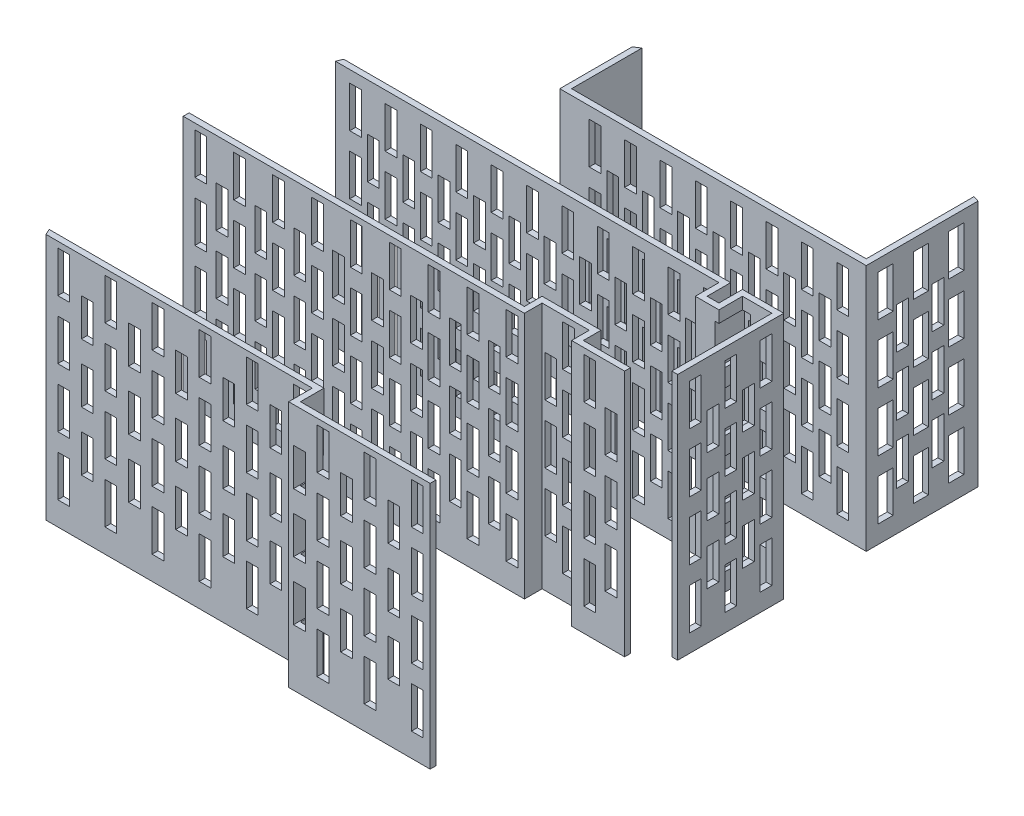
from build123d import *

# Parameters (mm, degrees)
EXTRUDE_1_DEPTH     = 21
EXTRUDE_1_2_DEPTH   = 21
EXTRUDE_1_3_DEPTH   = 21
EXTRUDE_1_4_DEPTH   = 21
SKETCH_3_W          = 1
SKETCH_3_H          = 3.5
SKETCH_3_H_2        = 3.183776242
CUT_EXTRUDE_1_DEPTH = 5
SKETCH_4_W          = 1
SKETCH_4_H          = 3.5
CUT_EXTRUDE_2_DEPTH = 5
SKETCH_5_W          = 1
SKETCH_5_H          = 3.5
CUT_EXTRUDE_3_DEPTH = 3
SKETCH_6_W          = 1
SKETCH_6_H          = 3.5
CUT_EXTRUDE_4_DEPTH = 3
SKETCH_7_W          = 1
SKETCH_7_H          = 3.5
SKETCH_7_H_2        = 3.104321798
CUT_EXTRUDE_5_DEPTH = 2
SKETCH_8_W          = 1.279920776
SKETCH_8_H          = 3.5
SKETCH_8_W_2        = 1
CUT_EXTRUDE_6_DEPTH = 2


with BuildPart() as part:
    # 草图1 → 凸台-拉伸1 (new body)
    with BuildSketch(Plane(origin=(0, 0, 0), x_dir=(1, 0, 0), z_dir=(0, 1, 0))):
        with BuildLine():
            Line((-16, 25.966324345), (-16, 20))
            Line((-16, 20), (9, 20))
            Line((9, 20), (9, 29.141894242))
            Line((9, 29.141894242), (9.5, 28.982753492))
            Line((9.5, 28.982753492), (9.5, 19.5))
            Line((9.5, 19.5), (-16.5, 19.5))
            Line((-16.5, 19.5), (-16.5, 25.651510677))
            ThreePointArc((-16.5, 25.651510677), (-16.250762349, 25.810128304), (-16, 25.966324345))
        make_face()
    extrude(amount=EXTRUDE_1_DEPTH)

    # 草图5 → 切除-拉伸3 (cut)
    with BuildSketch(Plane(origin=(0, 0, -20), x_dir=(-1, 0, 0), z_dir=(0, 0, -1))):
        with Locations((-7.5, 18.25)):
            Rectangle(SKETCH_5_W, SKETCH_5_H)
        with Locations((-4.5, 18.25)):
            Rectangle(SKETCH_5_W, SKETCH_5_H)
        with Locations((-1.5, 18.25)):
            Rectangle(SKETCH_5_W, SKETCH_5_H)
        with Locations((1.5, 18.25)):
            Rectangle(SKETCH_5_W, SKETCH_5_H)
        with Locations((4.5, 18.25)):
            Rectangle(SKETCH_5_W, SKETCH_5_H)
        with Locations((7.5, 18.25)):
            Rectangle(SKETCH_5_W, SKETCH_5_H)
        with Locations((10.5, 18.25)):
            Rectangle(SKETCH_5_W, SKETCH_5_H)
        with Locations((13.5, 18.25)):
            Rectangle(SKETCH_5_W, SKETCH_5_H)
        with Locations((-7.5, 13.25)):
            Rectangle(SKETCH_5_W, SKETCH_5_H)
        with Locations((-4.5, 13.25)):
            Rectangle(SKETCH_5_W, SKETCH_5_H)
        with Locations((-1.5, 13.25)):
            Rectangle(SKETCH_5_W, SKETCH_5_H)
        with Locations((1.5, 13.25)):
            Rectangle(SKETCH_5_W, SKETCH_5_H)
        with Locations((4.5, 13.25)):
            Rectangle(SKETCH_5_W, SKETCH_5_H)
        with Locations((7.5, 13.25)):
            Rectangle(SKETCH_5_W, SKETCH_5_H)
        with Locations((10.5, 13.25)):
            Rectangle(SKETCH_5_W, SKETCH_5_H)
        with Locations((13.5, 13.25)):
            Rectangle(SKETCH_5_W, SKETCH_5_H)
        with Locations((-7.5, 8.25)):
            Rectangle(SKETCH_5_W, SKETCH_5_H)
        with Locations((-4.5, 8.25)):
            Rectangle(SKETCH_5_W, SKETCH_5_H)
        with Locations((-1.5, 8.25)):
            Rectangle(SKETCH_5_W, SKETCH_5_H)
        with Locations((1.5, 8.25)):
            Rectangle(SKETCH_5_W, SKETCH_5_H)
        with Locations((4.5, 8.25)):
            Rectangle(SKETCH_5_W, SKETCH_5_H)
        with Locations((7.5, 8.25)):
            Rectangle(SKETCH_5_W, SKETCH_5_H)
        with Locations((10.5, 8.25)):
            Rectangle(SKETCH_5_W, SKETCH_5_H)
        with Locations((13.5, 8.25)):
            Rectangle(SKETCH_5_W, SKETCH_5_H)
        with Locations((-7.5, 3.25)):
            Rectangle(SKETCH_5_W, SKETCH_5_H)
        with Locations((-4.5, 3.25)):
            Rectangle(SKETCH_5_W, SKETCH_5_H)
        with Locations((-1.5, 3.25)):
            Rectangle(SKETCH_5_W, SKETCH_5_H)
        with Locations((1.5, 3.25)):
            Rectangle(SKETCH_5_W, SKETCH_5_H)
        with Locations((4.5, 3.25)):
            Rectangle(SKETCH_5_W, SKETCH_5_H)
        with Locations((7.5, 3.25)):
            Rectangle(SKETCH_5_W, SKETCH_5_H)
        with Locations((10.5, 3.25)):
            Rectangle(SKETCH_5_W, SKETCH_5_H)
        with Locations((13.5, 3.25)):
            Rectangle(SKETCH_5_W, SKETCH_5_H)
        with Locations((-3, 15.25)):
            Rectangle(SKETCH_5_W, SKETCH_5_H)
        with Locations((-6, 15.25)):
            Rectangle(SKETCH_5_W, SKETCH_5_H)
        with Locations((0, 15.25)):
            Rectangle(SKETCH_5_W, SKETCH_5_H)
        with Locations((3, 15.25)):
            Rectangle(SKETCH_5_W, SKETCH_5_H)
        with Locations((6, 15.25)):
            Rectangle(SKETCH_5_W, SKETCH_5_H)
        with Locations((9, 15.25)):
            Rectangle(SKETCH_5_W, SKETCH_5_H)
        with Locations((12, 15.25)):
            Rectangle(SKETCH_5_W, SKETCH_5_H)
        with Locations((-6, 10.25)):
            Rectangle(SKETCH_5_W, SKETCH_5_H)
        with Locations((-3, 10.25)):
            Rectangle(SKETCH_5_W, SKETCH_5_H)
        with Locations((0, 10.25)):
            Rectangle(SKETCH_5_W, SKETCH_5_H)
        with Locations((3, 10.25)):
            Rectangle(SKETCH_5_W, SKETCH_5_H)
        with Locations((6, 10.25)):
            Rectangle(SKETCH_5_W, SKETCH_5_H)
        with Locations((9, 10.25)):
            Rectangle(SKETCH_5_W, SKETCH_5_H)
        with Locations((12, 10.25)):
            Rectangle(SKETCH_5_W, SKETCH_5_H)
        with Locations((-6, 5.25)):
            Rectangle(SKETCH_5_W, SKETCH_5_H)
        with Locations((-3, 5.25)):
            Rectangle(SKETCH_5_W, SKETCH_5_H)
        with Locations((0, 5.25)):
            Rectangle(SKETCH_5_W, SKETCH_5_H)
        with Locations((3, 5.25)):
            Rectangle(SKETCH_5_W, SKETCH_5_H)
        with Locations((6, 5.25)):
            Rectangle(SKETCH_5_W, SKETCH_5_H)
        with Locations((9, 5.25)):
            Rectangle(SKETCH_5_W, SKETCH_5_H)
        with Locations((12, 5.25)):
            Rectangle(SKETCH_5_W, SKETCH_5_H)
    extrude(amount=-CUT_EXTRUDE_3_DEPTH, mode=Mode.SUBTRACT)

    # 草图8 → 切除-拉伸6 (cut)
    with BuildSketch(Plane(origin=(9.5, 0, 0), x_dir=(0, 0, -1), z_dir=(1, 0, 0))):
        with Locations((21.139960388, 18.261135418)):
            Rectangle(SKETCH_8_W, SKETCH_8_H)
        with Locations((24.139960388, 18.261135418)):
            Rectangle(SKETCH_8_W, SKETCH_8_H)
        with Locations((27.139960388, 18.261135418)):
            Rectangle(SKETCH_8_W, SKETCH_8_H)
        with Locations((21.139960388, 13.261135418)):
            Rectangle(SKETCH_8_W, SKETCH_8_H)
        with Locations((24.139960388, 13.261135418)):
            Rectangle(SKETCH_8_W, SKETCH_8_H)
        with Locations((27.139960388, 13.261135418)):
            Rectangle(SKETCH_8_W, SKETCH_8_H)
        with Locations((21.139960388, 8.261135418)):
            Rectangle(SKETCH_8_W, SKETCH_8_H)
        with Locations((24.139960388, 8.261135418)):
            Rectangle(SKETCH_8_W, SKETCH_8_H)
        with Locations((27.139960388, 8.261135418)):
            Rectangle(SKETCH_8_W, SKETCH_8_H)
        with Locations((21.139960388, 3.261135418)):
            Rectangle(SKETCH_8_W, SKETCH_8_H)
        with Locations((24.139960388, 3.261135418)):
            Rectangle(SKETCH_8_W, SKETCH_8_H)
        with Locations((27.139960388, 3.261135418)):
            Rectangle(SKETCH_8_W, SKETCH_8_H)
        with Locations((25.579920776, 15.090919817)):
            Rectangle(SKETCH_8_W_2, SKETCH_8_H)
        with Locations((22.579920776, 15.090919817)):
            Rectangle(SKETCH_8_W_2, SKETCH_8_H)
        with Locations((22.579920776, 10.090919817)):
            Rectangle(SKETCH_8_W_2, SKETCH_8_H)
        with Locations((25.579920776, 10.090919817)):
            Rectangle(SKETCH_8_W_2, SKETCH_8_H)
        with Locations((22.579920776, 5.090919817)):
            Rectangle(SKETCH_8_W_2, SKETCH_8_H)
        with Locations((25.579920776, 5.090919817)):
            Rectangle(SKETCH_8_W_2, SKETCH_8_H)
    extrude(amount=-CUT_EXTRUDE_6_DEPTH, mode=Mode.SUBTRACT)


with BuildPart() as body_2:
    # 草图1 → Extrude 1 2 (new body)
    with BuildSketch(Plane(origin=(0, 0, 0), x_dir=(1, 0, 0), z_dir=(0, 1, 0))):
        with BuildLine():
            Line((-27.590759323, -13), (-5, -13))
            Line((-5, -13), (-5, -15))
            Line((-5, -15), (7, -15))
            Line((7, -15), (7, -14.5))
            Line((7, -14.5), (-4.5, -14.5))
            Line((-4.5, -14.5), (-4.5, -12.5))
            Line((-4.5, -12.5), (-27.820855486, -12.5))
            ThreePointArc((-27.820855486, -12.5), (-27.706935304, -12.750519051), (-27.590759323, -13))
        make_face()
    extrude(amount=EXTRUDE_1_2_DEPTH)

    # 草图3 → 切除-拉伸1 (cut)
    with BuildSketch(Plane.XY.offset(15)):
        with Locations((-26.090759323, 18.75)):
            Rectangle(SKETCH_3_W, SKETCH_3_H)
        with Locations((-22.090759323, 18.75)):
            Rectangle(SKETCH_3_W, SKETCH_3_H)
        with Locations((-18.090759323, 18.75)):
            Rectangle(SKETCH_3_W, SKETCH_3_H)
        with Locations((-14.090759323, 18.75)):
            Rectangle(SKETCH_3_W, SKETCH_3_H)
        with Locations((-10.090759323, 18.75)):
            Rectangle(SKETCH_3_W, SKETCH_3_H)
        with Locations((-6.090759323, 18.75)):
            Rectangle(SKETCH_3_W, SKETCH_3_H)
        with Locations((-2.090759323, 18.75)):
            Rectangle(SKETCH_3_W, SKETCH_3_H)
        with Locations((1.909240677, 18.75)):
            Rectangle(SKETCH_3_W, SKETCH_3_H)
        with Locations((5.909240677, 18.75)):
            Rectangle(SKETCH_3_W, SKETCH_3_H)
        with Locations((-26.090759323, 13.75)):
            Rectangle(SKETCH_3_W, SKETCH_3_H)
        with Locations((-22.090759323, 13.75)):
            Rectangle(SKETCH_3_W, SKETCH_3_H)
        with Locations((-18.090759323, 13.75)):
            Rectangle(SKETCH_3_W, SKETCH_3_H)
        with Locations((-14.090759323, 13.75)):
            Rectangle(SKETCH_3_W, SKETCH_3_H)
        with Locations((-10.090759323, 13.75)):
            Rectangle(SKETCH_3_W, SKETCH_3_H)
        with Locations((-6.090759323, 13.75)):
            Rectangle(SKETCH_3_W, SKETCH_3_H)
        with Locations((-2.090759323, 13.75)):
            Rectangle(SKETCH_3_W, SKETCH_3_H)
        with Locations((1.909240677, 13.75)):
            Rectangle(SKETCH_3_W, SKETCH_3_H)
        with Locations((5.909240677, 13.75)):
            Rectangle(SKETCH_3_W, SKETCH_3_H)
        with Locations((-26.090759323, 8.75)):
            Rectangle(SKETCH_3_W, SKETCH_3_H)
        with Locations((-22.090759323, 8.75)):
            Rectangle(SKETCH_3_W, SKETCH_3_H)
        with Locations((-18.090759323, 8.75)):
            Rectangle(SKETCH_3_W, SKETCH_3_H)
        with Locations((-14.090759323, 8.75)):
            Rectangle(SKETCH_3_W, SKETCH_3_H)
        with Locations((-10.090759323, 8.75)):
            Rectangle(SKETCH_3_W, SKETCH_3_H)
        with Locations((-6.090759323, 8.75)):
            Rectangle(SKETCH_3_W, SKETCH_3_H)
        with Locations((-2.090759323, 8.75)):
            Rectangle(SKETCH_3_W, SKETCH_3_H)
        with Locations((1.909240677, 8.75)):
            Rectangle(SKETCH_3_W, SKETCH_3_H)
        with Locations((5.909240677, 8.75)):
            Rectangle(SKETCH_3_W, SKETCH_3_H)
        with Locations((-26.090759323, 3.75)):
            Rectangle(SKETCH_3_W, SKETCH_3_H)
        with Locations((-22.090759323, 3.75)):
            Rectangle(SKETCH_3_W, SKETCH_3_H)
        with Locations((-18.090759323, 3.75)):
            Rectangle(SKETCH_3_W, SKETCH_3_H)
        with Locations((-14.090759323, 3.75)):
            Rectangle(SKETCH_3_W, SKETCH_3_H)
        with Locations((-10.090759323, 3.75)):
            Rectangle(SKETCH_3_W, SKETCH_3_H)
        with Locations((-6.090759323, 3.75)):
            Rectangle(SKETCH_3_W, SKETCH_3_H)
        with Locations((-2.090759323, 3.75)):
            Rectangle(SKETCH_3_W, SKETCH_3_H)
        with Locations((1.909240677, 3.75)):
            Rectangle(SKETCH_3_W, SKETCH_3_H)
        with Locations((5.909240677, 3.75)):
            Rectangle(SKETCH_3_W, SKETCH_3_H)
        with Locations((-20.090759323, 16.408111879)):
            Rectangle(SKETCH_3_W, SKETCH_3_H_2)
        with Locations((-24.090759323, 16.408111879)):
            Rectangle(SKETCH_3_W, SKETCH_3_H_2)
        with Locations((-16.090759323, 16.408111879)):
            Rectangle(SKETCH_3_W, SKETCH_3_H_2)
        with Locations((-12.090759323, 16.408111879)):
            Rectangle(SKETCH_3_W, SKETCH_3_H_2)
        with Locations((-8.090759323, 16.408111879)):
            Rectangle(SKETCH_3_W, SKETCH_3_H_2)
        with Locations((-4.090759323, 16.408111879)):
            Rectangle(SKETCH_3_W, SKETCH_3_H_2)
        with Locations((-0.090759323, 16.408111879)):
            Rectangle(SKETCH_3_W, SKETCH_3_H_2)
        with Locations((3.909240677, 16.408111879)):
            Rectangle(SKETCH_3_W, SKETCH_3_H_2)
        with Locations((-24.090759323, 11.408111879)):
            Rectangle(SKETCH_3_W, SKETCH_3_H_2)
        with Locations((-20.090759323, 11.408111879)):
            Rectangle(SKETCH_3_W, SKETCH_3_H_2)
        with Locations((-16.090759323, 11.408111879)):
            Rectangle(SKETCH_3_W, SKETCH_3_H_2)
        with Locations((-12.090759323, 11.408111879)):
            Rectangle(SKETCH_3_W, SKETCH_3_H_2)
        with Locations((-8.090759323, 11.408111879)):
            Rectangle(SKETCH_3_W, SKETCH_3_H_2)
        with Locations((-4.090759323, 11.408111879)):
            Rectangle(SKETCH_3_W, SKETCH_3_H_2)
        with Locations((-0.090759323, 11.408111879)):
            Rectangle(SKETCH_3_W, SKETCH_3_H_2)
        with Locations((3.909240677, 11.408111879)):
            Rectangle(SKETCH_3_W, SKETCH_3_H_2)
        with Locations((-24.090759323, 6.408111879)):
            Rectangle(SKETCH_3_W, SKETCH_3_H_2)
        with Locations((-20.090759323, 6.408111879)):
            Rectangle(SKETCH_3_W, SKETCH_3_H_2)
        with Locations((-16.090759323, 6.408111879)):
            Rectangle(SKETCH_3_W, SKETCH_3_H_2)
        with Locations((-12.090759323, 6.408111879)):
            Rectangle(SKETCH_3_W, SKETCH_3_H_2)
        with Locations((-8.090759323, 6.408111879)):
            Rectangle(SKETCH_3_W, SKETCH_3_H_2)
        with Locations((-4.090759323, 6.408111879)):
            Rectangle(SKETCH_3_W, SKETCH_3_H_2)
        with Locations((-0.090759323, 6.408111879)):
            Rectangle(SKETCH_3_W, SKETCH_3_H_2)
        with Locations((3.909240677, 6.408111879)):
            Rectangle(SKETCH_3_W, SKETCH_3_H_2)
    extrude(amount=-CUT_EXTRUDE_1_DEPTH, mode=Mode.SUBTRACT)


with BuildPart() as body_3:
    # 草图1 → Extrude 1 3 (new body)
    with BuildSketch(Plane(origin=(0, 0, 0), x_dir=(1, 0, 0), z_dir=(0, 1, 0))):
        with BuildLine():
            Line((-28.040149786, 12), (4.5, 12))
            Line((4.5, 12), (4.5, 10))
            Line((4.5, 10), (6.5, 10))
            Line((6.5, 10), (6.5, 12))
            Line((6.5, 12), (9, 12))
            Line((9, 12), (9, 3.500881967))
            Line((9, 3.500881967), (9.5, 3.500881967))
            Line((9.5, 3.500881967), (9.5, 12.5))
            Line((9.5, 12.5), (6, 12.5))
            Line((6, 12.5), (6, 10.5))
            Line((6, 10.5), (5, 10.5))
            Line((5, 10.5), (5, 12.5))
            Line((5, 12.5), (-27.820855486, 12.5))
            ThreePointArc((-27.820855486, 12.5), (-27.931621462, 12.250490704), (-28.040149786, 12))
        make_face()
    extrude(amount=EXTRUDE_1_3_DEPTH)

    # 草图6 → 切除-拉伸4 (cut)
    with BuildSketch(Plane(origin=(0, 0, -12.5), x_dir=(-1, 0, 0), z_dir=(0, 0, -1))):
        with Locations((26.320855486, 18.25)):
            Rectangle(SKETCH_6_W, SKETCH_6_H)
        with Locations((23.320855486, 18.25)):
            Rectangle(SKETCH_6_W, SKETCH_6_H)
        with Locations((20.320855486, 18.25)):
            Rectangle(SKETCH_6_W, SKETCH_6_H)
        with Locations((17.320855486, 18.25)):
            Rectangle(SKETCH_6_W, SKETCH_6_H)
        with Locations((14.320855486, 18.25)):
            Rectangle(SKETCH_6_W, SKETCH_6_H)
        with Locations((11.320855486, 18.25)):
            Rectangle(SKETCH_6_W, SKETCH_6_H)
        with Locations((8.320855486, 18.25)):
            Rectangle(SKETCH_6_W, SKETCH_6_H)
        with Locations((5.320855486, 18.25)):
            Rectangle(SKETCH_6_W, SKETCH_6_H)
        with Locations((2.320855486, 18.25)):
            Rectangle(SKETCH_6_W, SKETCH_6_H)
        with Locations((-0.679144514, 18.25)):
            Rectangle(SKETCH_6_W, SKETCH_6_H)
        with Locations((-3.679144514, 18.25)):
            Rectangle(SKETCH_6_W, SKETCH_6_H)
        with Locations((-6.679144514, 18.25)):
            Rectangle(SKETCH_6_W, SKETCH_6_H)
        with Locations((26.320855486, 13.25)):
            Rectangle(SKETCH_6_W, SKETCH_6_H)
        with Locations((23.320855486, 13.25)):
            Rectangle(SKETCH_6_W, SKETCH_6_H)
        with Locations((20.320855486, 13.25)):
            Rectangle(SKETCH_6_W, SKETCH_6_H)
        with Locations((17.320855486, 13.25)):
            Rectangle(SKETCH_6_W, SKETCH_6_H)
        with Locations((14.320855486, 13.25)):
            Rectangle(SKETCH_6_W, SKETCH_6_H)
        with Locations((11.320855486, 13.25)):
            Rectangle(SKETCH_6_W, SKETCH_6_H)
        with Locations((8.320855486, 13.25)):
            Rectangle(SKETCH_6_W, SKETCH_6_H)
        with Locations((5.320855486, 13.25)):
            Rectangle(SKETCH_6_W, SKETCH_6_H)
        with Locations((2.320855486, 13.25)):
            Rectangle(SKETCH_6_W, SKETCH_6_H)
        with Locations((-0.679144514, 13.25)):
            Rectangle(SKETCH_6_W, SKETCH_6_H)
        with Locations((-3.679144514, 13.25)):
            Rectangle(SKETCH_6_W, SKETCH_6_H)
        with Locations((-6.679144514, 13.25)):
            Rectangle(SKETCH_6_W, SKETCH_6_H)
        with Locations((26.320855486, 8.25)):
            Rectangle(SKETCH_6_W, SKETCH_6_H)
        with Locations((23.320855486, 8.25)):
            Rectangle(SKETCH_6_W, SKETCH_6_H)
        with Locations((20.320855486, 8.25)):
            Rectangle(SKETCH_6_W, SKETCH_6_H)
        with Locations((17.320855486, 8.25)):
            Rectangle(SKETCH_6_W, SKETCH_6_H)
        with Locations((14.320855486, 8.25)):
            Rectangle(SKETCH_6_W, SKETCH_6_H)
        with Locations((11.320855486, 8.25)):
            Rectangle(SKETCH_6_W, SKETCH_6_H)
        with Locations((8.320855486, 8.25)):
            Rectangle(SKETCH_6_W, SKETCH_6_H)
        with Locations((5.320855486, 8.25)):
            Rectangle(SKETCH_6_W, SKETCH_6_H)
        with Locations((2.320855486, 8.25)):
            Rectangle(SKETCH_6_W, SKETCH_6_H)
        with Locations((-0.679144514, 8.25)):
            Rectangle(SKETCH_6_W, SKETCH_6_H)
        with Locations((-3.679144514, 8.25)):
            Rectangle(SKETCH_6_W, SKETCH_6_H)
        with Locations((-6.679144514, 8.25)):
            Rectangle(SKETCH_6_W, SKETCH_6_H)
        with Locations((26.320855486, 3.25)):
            Rectangle(SKETCH_6_W, SKETCH_6_H)
        with Locations((23.320855486, 3.25)):
            Rectangle(SKETCH_6_W, SKETCH_6_H)
        with Locations((20.320855486, 3.25)):
            Rectangle(SKETCH_6_W, SKETCH_6_H)
        with Locations((17.320855486, 3.25)):
            Rectangle(SKETCH_6_W, SKETCH_6_H)
        with Locations((14.320855486, 3.25)):
            Rectangle(SKETCH_6_W, SKETCH_6_H)
        with Locations((11.320855486, 3.25)):
            Rectangle(SKETCH_6_W, SKETCH_6_H)
        with Locations((8.320855486, 3.25)):
            Rectangle(SKETCH_6_W, SKETCH_6_H)
        with Locations((5.320855486, 3.25)):
            Rectangle(SKETCH_6_W, SKETCH_6_H)
        with Locations((2.320855486, 3.25)):
            Rectangle(SKETCH_6_W, SKETCH_6_H)
        with Locations((-0.679144514, 3.25)):
            Rectangle(SKETCH_6_W, SKETCH_6_H)
        with Locations((-3.679144514, 3.25)):
            Rectangle(SKETCH_6_W, SKETCH_6_H)
        with Locations((-6.679144514, 3.25)):
            Rectangle(SKETCH_6_W, SKETCH_6_H)
        with Locations((21.820855486, 15.25)):
            Rectangle(SKETCH_6_W, SKETCH_6_H)
        with Locations((24.820855486, 15.25)):
            Rectangle(SKETCH_6_W, SKETCH_6_H)
        with Locations((18.820855486, 15.25)):
            Rectangle(SKETCH_6_W, SKETCH_6_H)
        with Locations((15.820855486, 15.25)):
            Rectangle(SKETCH_6_W, SKETCH_6_H)
        with Locations((12.820855486, 15.25)):
            Rectangle(SKETCH_6_W, SKETCH_6_H)
        with Locations((9.820855486, 15.25)):
            Rectangle(SKETCH_6_W, SKETCH_6_H)
        with Locations((6.820855486, 15.25)):
            Rectangle(SKETCH_6_W, SKETCH_6_H)
        with Locations((3.820855486, 15.25)):
            Rectangle(SKETCH_6_W, SKETCH_6_H)
        with Locations((0.820855486, 15.25)):
            Rectangle(SKETCH_6_W, SKETCH_6_H)
        with Locations((-2.179144514, 15.25)):
            Rectangle(SKETCH_6_W, SKETCH_6_H)
        with Locations((-8.179144514, 15.25)):
            Rectangle(SKETCH_6_W, SKETCH_6_H)
        with Locations((24.820855486, 10.25)):
            Rectangle(SKETCH_6_W, SKETCH_6_H)
        with Locations((-8.179144514, 10.25)):
            Rectangle(SKETCH_6_W, SKETCH_6_H)
        with Locations((-2.179144514, 10.25)):
            Rectangle(SKETCH_6_W, SKETCH_6_H)
        with Locations((0.820855486, 10.25)):
            Rectangle(SKETCH_6_W, SKETCH_6_H)
        with Locations((3.820855486, 10.25)):
            Rectangle(SKETCH_6_W, SKETCH_6_H)
        with Locations((6.820855486, 10.25)):
            Rectangle(SKETCH_6_W, SKETCH_6_H)
        with Locations((9.820855486, 10.25)):
            Rectangle(SKETCH_6_W, SKETCH_6_H)
        with Locations((12.820855486, 10.25)):
            Rectangle(SKETCH_6_W, SKETCH_6_H)
        with Locations((15.820855486, 10.25)):
            Rectangle(SKETCH_6_W, SKETCH_6_H)
        with Locations((18.820855486, 10.25)):
            Rectangle(SKETCH_6_W, SKETCH_6_H)
        with Locations((21.820855486, 10.25)):
            Rectangle(SKETCH_6_W, SKETCH_6_H)
        with Locations((24.820855486, 5.25)):
            Rectangle(SKETCH_6_W, SKETCH_6_H)
        with Locations((-8.179144514, 5.25)):
            Rectangle(SKETCH_6_W, SKETCH_6_H)
        with Locations((-2.179144514, 5.25)):
            Rectangle(SKETCH_6_W, SKETCH_6_H)
        with Locations((0.820855486, 5.25)):
            Rectangle(SKETCH_6_W, SKETCH_6_H)
        with Locations((3.820855486, 5.25)):
            Rectangle(SKETCH_6_W, SKETCH_6_H)
        with Locations((6.820855486, 5.25)):
            Rectangle(SKETCH_6_W, SKETCH_6_H)
        with Locations((9.820855486, 5.25)):
            Rectangle(SKETCH_6_W, SKETCH_6_H)
        with Locations((12.820855486, 5.25)):
            Rectangle(SKETCH_6_W, SKETCH_6_H)
        with Locations((15.820855486, 5.25)):
            Rectangle(SKETCH_6_W, SKETCH_6_H)
        with Locations((18.820855486, 5.25)):
            Rectangle(SKETCH_6_W, SKETCH_6_H)
        with Locations((21.820855486, 5.25)):
            Rectangle(SKETCH_6_W, SKETCH_6_H)
    extrude(amount=-CUT_EXTRUDE_4_DEPTH, mode=Mode.SUBTRACT)

    # 草图7 → 切除-拉伸5 (cut)
    with BuildSketch(Plane(origin=(9.5, 0, 0), x_dir=(0, 0, -1), z_dir=(1, 0, 0))):
        with Locations((11, 18.25)):
            Rectangle(SKETCH_7_W, SKETCH_7_H)
        with Locations((8, 18.25)):
            Rectangle(SKETCH_7_W, SKETCH_7_H)
        with Locations((5, 18.25)):
            Rectangle(SKETCH_7_W, SKETCH_7_H)
        with Locations((11, 13.25)):
            Rectangle(SKETCH_7_W, SKETCH_7_H)
        with Locations((5, 13.25)):
            Rectangle(SKETCH_7_W, SKETCH_7_H)
        with Locations((8, 13.25)):
            Rectangle(SKETCH_7_W, SKETCH_7_H)
        with Locations((11, 8.25)):
            Rectangle(SKETCH_7_W, SKETCH_7_H)
        with Locations((5, 8.25)):
            Rectangle(SKETCH_7_W, SKETCH_7_H)
        with Locations((8, 8.25)):
            Rectangle(SKETCH_7_W, SKETCH_7_H)
        with Locations((11, 3.25)):
            Rectangle(SKETCH_7_W, SKETCH_7_H)
        with Locations((5, 3.25)):
            Rectangle(SKETCH_7_W, SKETCH_7_H)
        with Locations((8, 3.25)):
            Rectangle(SKETCH_7_W, SKETCH_7_H)
        with Locations((6.5, 15.55196402)):
            Rectangle(SKETCH_7_W, SKETCH_7_H_2)
        with Locations((9.5, 15.55196402)):
            Rectangle(SKETCH_7_W, SKETCH_7_H_2)
        with Locations((9.5, 10.55196402)):
            Rectangle(SKETCH_7_W, SKETCH_7_H_2)
        with Locations((6.5, 10.55196402)):
            Rectangle(SKETCH_7_W, SKETCH_7_H_2)
        with Locations((9.5, 5.55196402)):
            Rectangle(SKETCH_7_W, SKETCH_7_H_2)
        with Locations((6.5, 5.55196402)):
            Rectangle(SKETCH_7_W, SKETCH_7_H_2)
    extrude(amount=-CUT_EXTRUDE_5_DEPTH, mode=Mode.SUBTRACT)


with BuildPart() as body_4:
    # 草图1 → Extrude 1 4 (new body)
    with BuildSketch(Plane(origin=(0, 0, 0), x_dir=(1, 0, 0), z_dir=(0, 1, 0))):
        with BuildLine():
            Line((7, 2), (3, 2))
            Line((3, 2), (3, 3.5))
            Line((3, 3.5), (-2, 3.5))
            Line((-2, 3.5), (-2, 2))
            Line((-2, 2), (-30.434355587, 2))
            ThreePointArc((-30.434355587, 2), (-30.449750304, 1.750058985), (-30.463092423, 1.5))
            Line((-30.463092423, 1.5), (-1.5, 1.5))
            Line((-1.5, 1.5), (-1.5, 3))
            Line((-1.5, 3), (2.5, 3))
            Line((2.5, 3), (2.5, 1.5))
            Line((2.5, 1.5), (7, 1.5))
            Line((7, 1.5), (7, 2))
        make_face()
    extrude(amount=EXTRUDE_1_4_DEPTH)

    # 草图4 → 切除-拉伸2 (cut)
    with BuildSketch(Plane.XY.offset(-1.5)):
        with Locations((-28.963092423, 18.75)):
            Rectangle(SKETCH_4_W, SKETCH_4_H)
        with Locations((-25.663092423, 18.75)):
            Rectangle(SKETCH_4_W, SKETCH_4_H)
        with Locations((-22.363092423, 18.75)):
            Rectangle(SKETCH_4_W, SKETCH_4_H)
        with Locations((-19.063092423, 18.75)):
            Rectangle(SKETCH_4_W, SKETCH_4_H)
        with Locations((-15.763092423, 18.75)):
            Rectangle(SKETCH_4_W, SKETCH_4_H)
        with Locations((-12.463092423, 18.75)):
            Rectangle(SKETCH_4_W, SKETCH_4_H)
        with Locations((-9.163092423, 18.75)):
            Rectangle(SKETCH_4_W, SKETCH_4_H)
        with Locations((-5.863092423, 18.75)):
            Rectangle(SKETCH_4_W, SKETCH_4_H)
        with Locations((-2.563092423, 18.75)):
            Rectangle(SKETCH_4_W, SKETCH_4_H)
        with Locations((0.736907577, 18.75)):
            Rectangle(SKETCH_4_W, SKETCH_4_H)
        with Locations((4.036907577, 18.75)):
            Rectangle(SKETCH_4_W, SKETCH_4_H)
        with Locations((-28.963092423, 13.75)):
            Rectangle(SKETCH_4_W, SKETCH_4_H)
        with Locations((-25.663092423, 13.75)):
            Rectangle(SKETCH_4_W, SKETCH_4_H)
        with Locations((-22.363092423, 13.75)):
            Rectangle(SKETCH_4_W, SKETCH_4_H)
        with Locations((-19.063092423, 13.75)):
            Rectangle(SKETCH_4_W, SKETCH_4_H)
        with Locations((-15.763092423, 13.75)):
            Rectangle(SKETCH_4_W, SKETCH_4_H)
        with Locations((-12.463092423, 13.75)):
            Rectangle(SKETCH_4_W, SKETCH_4_H)
        with Locations((-9.163092423, 13.75)):
            Rectangle(SKETCH_4_W, SKETCH_4_H)
        with Locations((-5.863092423, 13.75)):
            Rectangle(SKETCH_4_W, SKETCH_4_H)
        with Locations((-2.563092423, 13.75)):
            Rectangle(SKETCH_4_W, SKETCH_4_H)
        with Locations((0.736907577, 13.75)):
            Rectangle(SKETCH_4_W, SKETCH_4_H)
        with Locations((4.036907577, 13.75)):
            Rectangle(SKETCH_4_W, SKETCH_4_H)
        with Locations((-28.963092423, 8.75)):
            Rectangle(SKETCH_4_W, SKETCH_4_H)
        with Locations((-25.663092423, 8.75)):
            Rectangle(SKETCH_4_W, SKETCH_4_H)
        with Locations((-22.363092423, 8.75)):
            Rectangle(SKETCH_4_W, SKETCH_4_H)
        with Locations((-19.063092423, 8.75)):
            Rectangle(SKETCH_4_W, SKETCH_4_H)
        with Locations((-15.763092423, 8.75)):
            Rectangle(SKETCH_4_W, SKETCH_4_H)
        with Locations((-12.463092423, 8.75)):
            Rectangle(SKETCH_4_W, SKETCH_4_H)
        with Locations((-9.163092423, 8.75)):
            Rectangle(SKETCH_4_W, SKETCH_4_H)
        with Locations((-5.863092423, 8.75)):
            Rectangle(SKETCH_4_W, SKETCH_4_H)
        with Locations((-2.563092423, 8.75)):
            Rectangle(SKETCH_4_W, SKETCH_4_H)
        with Locations((0.736907577, 8.75)):
            Rectangle(SKETCH_4_W, SKETCH_4_H)
        with Locations((4.036907577, 8.75)):
            Rectangle(SKETCH_4_W, SKETCH_4_H)
        with Locations((-28.963092423, 3.75)):
            Rectangle(SKETCH_4_W, SKETCH_4_H)
        with Locations((-25.663092423, 3.75)):
            Rectangle(SKETCH_4_W, SKETCH_4_H)
        with Locations((-22.363092423, 3.75)):
            Rectangle(SKETCH_4_W, SKETCH_4_H)
        with Locations((-19.063092423, 3.75)):
            Rectangle(SKETCH_4_W, SKETCH_4_H)
        with Locations((-15.763092423, 3.75)):
            Rectangle(SKETCH_4_W, SKETCH_4_H)
        with Locations((-12.463092423, 3.75)):
            Rectangle(SKETCH_4_W, SKETCH_4_H)
        with Locations((-9.163092423, 3.75)):
            Rectangle(SKETCH_4_W, SKETCH_4_H)
        with Locations((-5.863092423, 3.75)):
            Rectangle(SKETCH_4_W, SKETCH_4_H)
        with Locations((-2.563092423, 3.75)):
            Rectangle(SKETCH_4_W, SKETCH_4_H)
        with Locations((0.736907577, 3.75)):
            Rectangle(SKETCH_4_W, SKETCH_4_H)
        with Locations((4.036907577, 3.75)):
            Rectangle(SKETCH_4_W, SKETCH_4_H)
        with Locations((-23.863092423, 15.75)):
            Rectangle(SKETCH_4_W, SKETCH_4_H)
        with Locations((-27.163092423, 15.75)):
            Rectangle(SKETCH_4_W, SKETCH_4_H)
        with Locations((-20.563092423, 15.75)):
            Rectangle(SKETCH_4_W, SKETCH_4_H)
        with Locations((-17.263092423, 15.75)):
            Rectangle(SKETCH_4_W, SKETCH_4_H)
        with Locations((-13.963092423, 15.75)):
            Rectangle(SKETCH_4_W, SKETCH_4_H)
        with Locations((-10.663092423, 15.75)):
            Rectangle(SKETCH_4_W, SKETCH_4_H)
        with Locations((-7.363092423, 15.75)):
            Rectangle(SKETCH_4_W, SKETCH_4_H)
        with Locations((-4.063092423, 15.75)):
            Rectangle(SKETCH_4_W, SKETCH_4_H)
        with Locations((-0.763092423, 15.75)):
            Rectangle(SKETCH_4_W, SKETCH_4_H)
        with Locations((5.836907577, 15.75)):
            Rectangle(SKETCH_4_W, SKETCH_4_H)
        with Locations((-27.163092423, 10.75)):
            Rectangle(SKETCH_4_W, SKETCH_4_H)
        with Locations((-23.863092423, 10.75)):
            Rectangle(SKETCH_4_W, SKETCH_4_H)
        with Locations((-20.563092423, 10.75)):
            Rectangle(SKETCH_4_W, SKETCH_4_H)
        with Locations((-17.263092423, 10.75)):
            Rectangle(SKETCH_4_W, SKETCH_4_H)
        with Locations((-13.963092423, 10.75)):
            Rectangle(SKETCH_4_W, SKETCH_4_H)
        with Locations((-10.663092423, 10.75)):
            Rectangle(SKETCH_4_W, SKETCH_4_H)
        with Locations((-7.363092423, 10.75)):
            Rectangle(SKETCH_4_W, SKETCH_4_H)
        with Locations((-4.063092423, 10.75)):
            Rectangle(SKETCH_4_W, SKETCH_4_H)
        with Locations((-0.763092423, 10.75)):
            Rectangle(SKETCH_4_W, SKETCH_4_H)
        with Locations((5.836907577, 10.75)):
            Rectangle(SKETCH_4_W, SKETCH_4_H)
        with Locations((-27.163092423, 5.75)):
            Rectangle(SKETCH_4_W, SKETCH_4_H)
        with Locations((-23.863092423, 5.75)):
            Rectangle(SKETCH_4_W, SKETCH_4_H)
        with Locations((-20.563092423, 5.75)):
            Rectangle(SKETCH_4_W, SKETCH_4_H)
        with Locations((-17.263092423, 5.75)):
            Rectangle(SKETCH_4_W, SKETCH_4_H)
        with Locations((-13.963092423, 5.75)):
            Rectangle(SKETCH_4_W, SKETCH_4_H)
        with Locations((-10.663092423, 5.75)):
            Rectangle(SKETCH_4_W, SKETCH_4_H)
        with Locations((-7.363092423, 5.75)):
            Rectangle(SKETCH_4_W, SKETCH_4_H)
        with Locations((-4.063092423, 5.75)):
            Rectangle(SKETCH_4_W, SKETCH_4_H)
        with Locations((-0.763092423, 5.75)):
            Rectangle(SKETCH_4_W, SKETCH_4_H)
        with Locations((5.836907577, 5.75)):
            Rectangle(SKETCH_4_W, SKETCH_4_H)
    extrude(amount=-CUT_EXTRUDE_2_DEPTH, mode=Mode.SUBTRACT)


solid = Compound([part.part, body_2.part, body_3.part, body_4.part])
